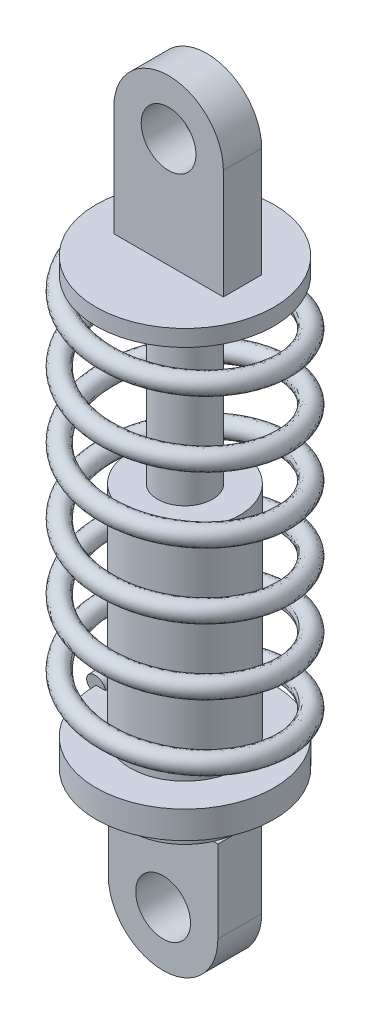
from build123d import *

# Parameters (mm, degrees)
SKETCH_1_W          = 20
SKETCH_1_H          = 25
EXTRUDE_1_DEPTH     = 8
SKETCH_2_R          = 5
CUT_EXTRUDE_1_DEPTH = 8
SKETCH_3_R          = 10
EXTRUDE_2_DEPTH     = 5
SKETCH_4_R          = 16.240761375
EXTRUDE_3_DEPTH     = 5
SKETCH_5_R          = 10
EXTRUDE_4_DEPTH     = 40
SKETCH_6_R          = 5
EXTRUDE_5_DEPTH     = 33
SKETCH_7_R          = 16.240761375
EXTRUDE_6_DEPTH     = 3
SWEEP_1_PITCH       = 12
SKETCH_43_R         = 5
EXTRUDE_7_DEPTH     = 7


with BuildPart() as part:
    # 草图1 → 凸台-拉伸1 (new body)
    with BuildSketch(Plane.XY):
        with Locations((10, -12.5)):
            Rectangle(SKETCH_1_W, SKETCH_1_H)
    extrude(amount=EXTRUDE_1_DEPTH)

    # 草图2 → 切除-拉伸1 (cut)
    with BuildSketch(Plane.XY.offset(8)):
        with Locations((10, -15)):
            Circle(SKETCH_2_R)
        with BuildLine():
            Line((20, -15), (22.408643279, -15))
            Line((22.408643279, -15), (25.453667977, -29.826467669))
            Line((25.453667977, -29.826467669), (9.434219656, -31.68302625))
            Line((9.434219656, -31.68302625), (-4.4104029, -25.742038793))
            Line((-4.4104029, -25.742038793), (0, -15))
            ThreePointArc((0, -15), (10, -25), (20, -15))
        make_face()
    extrude(amount=-CUT_EXTRUDE_1_DEPTH, mode=Mode.SUBTRACT)

    # 草图3 → 凸台-拉伸2 (add)
    with BuildSketch(Plane(origin=(0, 0, 0), x_dir=(1, 0, 0), z_dir=(0, 1, 0))):
        with Locations(Location((10, -4, 0), (0, 0, 156.421821522))):
            Circle(SKETCH_3_R)
    extrude(amount=EXTRUDE_2_DEPTH)

    # 草图4 → 凸台-拉伸3 (add)
    with BuildSketch(Plane(origin=(0, 5, 0), x_dir=(1, 0, 0), z_dir=(0, 1, 0))):
        with Locations(Location((10, -4, 0), (0, 0, 270))):
            Circle(SKETCH_4_R)
    extrude(amount=EXTRUDE_3_DEPTH)

    # 草图5 → 凸台-拉伸4 (add)
    with BuildSketch(Plane(origin=(0, 10, 0), x_dir=(1, 0, 0), z_dir=(0, 1, 0))):
        with Locations(Location((10, -4, 0), (0, 0, 156.421821522))):
            Circle(SKETCH_5_R)
    extrude(amount=EXTRUDE_4_DEPTH)

    # 草图6 → 凸台-拉伸5 (add)
    with BuildSketch(Plane(origin=(0, 50, 0), x_dir=(1, 0, 0), z_dir=(0, 1, 0))):
        with Locations(Location((10, -4, 0), (0, 0, 270))):
            Circle(SKETCH_6_R)
    extrude(amount=EXTRUDE_5_DEPTH)

    # 草图7 → 凸台-拉伸6 (add)
    with BuildSketch(Plane(origin=(0, 83, 0), x_dir=(1, 0, 0), z_dir=(0, 1, 0))):
        with Locations(Location((10, -4, 0), (0, 0, 270))):
            Circle(SKETCH_7_R)
    extrude(amount=EXTRUDE_6_DEPTH)

    # 扫描1: the profile of 扫描1 profile screwed along a left-hand helix of 6 turns, 16 arcs to a turn; built about Z, then put on its axis
    sweep_1_z = Axis((0, 0, 0), (0, 0, 1))
    sweep_1_corners = [(16.240761375, -0.198546193, -1.688365899), (17.940761375, 0, 0), (16.240761375, 0.198546193, 1.688365899), (14.540761375, 0, 0)]
    with BuildLine(mode=Mode.PRIVATE) as sweep_1_profile:
        ThreePointArc((16.240761375, -0.198546193, -1.688365899), (17.442842903, -0.140393359, -1.193854976), (17.940761375, 0, 0))
        ThreePointArc((17.940761375, 0, 0), (17.442842903, 0.140393359, 1.193854976), (16.240761375, 0.198546193, 1.688365899))
        ThreePointArc((16.240761375, 0.198546193, 1.688365899), (15.038679847, 0.140393359, 1.193854976), (14.540761375, 0, 0))
        ThreePointArc((14.540761375, 0, 0), (15.038679847, -0.140393359, -1.193854976), (16.240761375, -0.198546193, -1.688365899))
    sweep_1_cap = Face(sweep_1_profile.wire())
    sweep_1_arcs = [((16.240761375, -0.198546193, -1.688365899), (17.940761375, -0.198546193, -1.688365899), (17.940761375, 0, 0), (1, 0.7071067811865476, 1)), ((17.940761375, 0, 0), (17.940761375, 0.198546193, 1.688365899), (16.240761375, 0.198546193, 1.688365899), (1, 0.7071067811865476, 1)), ((16.240761375, 0.198546193, 1.688365899), (14.540761375, 0.198546193, 1.688365899), (14.540761375, 0, 0), (1, 0.7071067811865476, 1)), ((14.540761375, 0, 0), (14.540761375, -0.198546193, -1.688365899), (16.240761375, -0.198546193, -1.688365899), (1, 0.7071067811865476, 1))]  # start, shoulder, end, weights
    sweep_1_turn_angles = [0, -11.25, -22.5, -33.75, -45, -56.25, -67.5, -78.75, -90, -101.25, -112.5, -123.75, -135, -146.25, -157.5, -168.75, -180, -191.25, -202.5, -213.75, -225, -236.25, -247.5, -258.75, -270, -281.25, -292.5, -303.75, -315, -326.25, -337.5, -348.75, -360]
    sweep_1_turn_weights = [1, 0.9807852804032304, 1, 0.9807852804032304, 1, 0.9807852804032304, 1, 0.9807852804032304, 1, 0.9807852804032304, 1, 0.9807852804032304, 1, 0.9807852804032304, 1, 0.9807852804032304, 1, 0.9807852804032304, 1, 0.9807852804032304, 1, 0.9807852804032304, 1, 0.9807852804032304, 1, 0.9807852804032304, 1, 0.9807852804032304, 1, 0.9807852804032304, 1, 0.9807852804032304, 1]
    sweep_1_turn_sides = [Face.make_bezier_surface([[Vector(p[j][0], p[j][1], 0).rotate(sweep_1_z, sweep_1_turn_angles[2 * i + k]) / sweep_1_turn_weights[2 * i + k] + Vector(0, 0, p[j][2] + -SWEEP_1_PITCH * sweep_1_turn_angles[2 * i + k] / 360) for k in range(3)] for j in range(3)], [[p[3][j] * sweep_1_turn_weights[2 * i + k] for k in range(3)] for j in range(3)]) for p in sweep_1_arcs for i in range(16)]
    sweep_1 = Plane(origin=(10, 10, 4), x_dir=(-1, 0, 0), z_dir=(0, 1, 0)) * Solid(Shell([*[p.moved(Location((0, 0, SWEEP_1_PITCH * i))) for i in range(6) for p in sweep_1_turn_sides], sweep_1_cap, sweep_1_cap.rotate(sweep_1_z, -2160).moved(Location((0, 0, -SWEEP_1_PITCH * -2160 / 360)))]))
    add(sweep_1)

    # 草图43 → 凸台-拉伸7 (add)
    with BuildSketch(Plane(origin=(0, 0, 0), x_dir=(-1, 0, 0), z_dir=(0, 0, -1))):
        with BuildLine():
            Line((0, 86), (-20, 86))
            Line((-20, 86), (-20, 106))
            ThreePointArc((-20, 106), (-10, 116), (0, 106))
            Line((0, 106), (0, 86))
        make_face()
        with Locations((-10, 106)):
            Circle(SKETCH_43_R, mode=Mode.SUBTRACT)
    extrude(amount=-EXTRUDE_7_DEPTH)


solid = part.part
